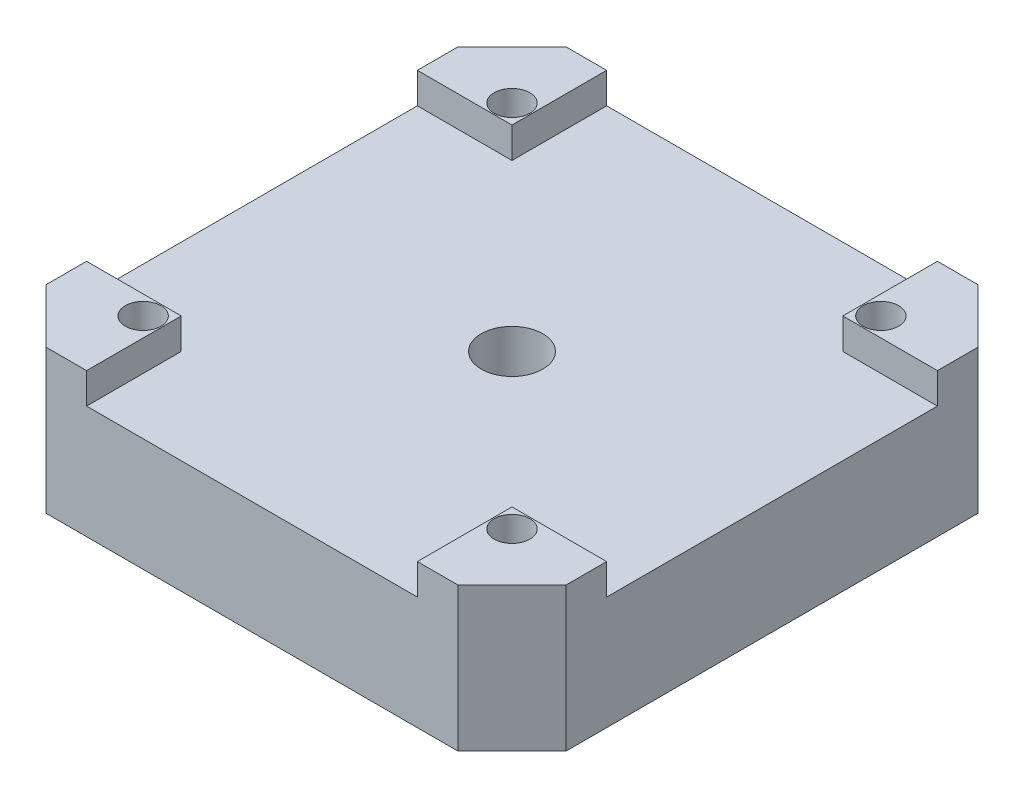
from build123d import *

# Parameters (mm, degrees)
BOSS_EXTRUDE1_DEPTH                                = 11.7
SKETCH12_W                                         = 26.901846944
SKETCH12_H                                         = 2.5
CUT_EXTRUDE6_DEPTH                                 = 49.718605276
SKETCH13_W                                         = 26.901846944
SKETCH13_H                                         = 2.5
CUT_EXTRUDE7_DEPTH                                 = 49.718605276
SKETCH14_R                                         = 3.25
CUT_EXTRUDE8_DEPTH                                 = 3
SKETCH15_R                                         = 2.5
CUT_EXTRUDE9_DEPTH                                 = 32.150200641
CBORE_FOR_M2_5_PAN_HEAD_MACHINE_SCREW1_D           = 2.9
CBORE_FOR_M2_5_PAN_HEAD_MACHINE_SCREW1_CBORE_D     = 6
CBORE_FOR_M2_5_PAN_HEAD_MACHINE_SCREW1_CBORE_DEPTH = 2.1


with BuildPart() as part:
    # Sketch1 → Boss-Extrude1 (new body)
    with BuildSketch(Plane(origin=(0, 0, 0), x_dir=(1, 0, 0), z_dir=(0, 1, 0))):
        Polygon((-21.15, 16.750923472), (-16.750923472, 21.15), (16.750923472, 21.15), (21.15, 16.750923472), (21.15, -16.750923472), (16.750923472, -21.15), (-16.750923472, -21.15), (-21.15, -16.750923472), align=None)
    extrude(amount=BOSS_EXTRUDE1_DEPTH)

    # Sketch12 → Cut-Extrude6 (cut, through all)
    with BuildSketch(Plane(origin=(21.15, 0, 0), x_dir=(0, 0, -1), z_dir=(1, 0, 0))):
        with Locations((0, 10.45)):
            Rectangle(SKETCH12_W, SKETCH12_H)
    extrude(amount=-CUT_EXTRUDE6_DEPTH, mode=Mode.SUBTRACT)

    # Sketch13 → Cut-Extrude7 (cut, through all)
    with BuildSketch(Plane.XY.offset(21.15)):
        with Locations((0, 10.45)):
            Rectangle(SKETCH13_W, SKETCH13_H)
    extrude(amount=-CUT_EXTRUDE7_DEPTH, mode=Mode.SUBTRACT)

    # Sketch14 → Cut-Extrude8 (cut)
    with BuildSketch(Plane.XZ):
        Circle(SKETCH14_R)
    extrude(amount=-CUT_EXTRUDE8_DEPTH, mode=Mode.SUBTRACT)

    # Sketch15 → Cut-Extrude9 (cut, through all)
    with BuildSketch(Plane.XZ.offset(-3)):
        Circle(SKETCH15_R)
    extrude(amount=-CUT_EXTRUDE9_DEPTH, mode=Mode.SUBTRACT)

    # CBORE for M2.5 Pan Head Machine Screw1 (through all)
    with Locations(Plane(origin=(0, 0, 0), x_dir=(-1, 0, 0), z_dir=(0, -1, 0))):
        with Locations((15, -15), (-15, -15), (-15, 15), (15, 15)):
            CounterBoreHole(CBORE_FOR_M2_5_PAN_HEAD_MACHINE_SCREW1_D / 2, CBORE_FOR_M2_5_PAN_HEAD_MACHINE_SCREW1_CBORE_D / 2, CBORE_FOR_M2_5_PAN_HEAD_MACHINE_SCREW1_CBORE_DEPTH)


solid = part.part
